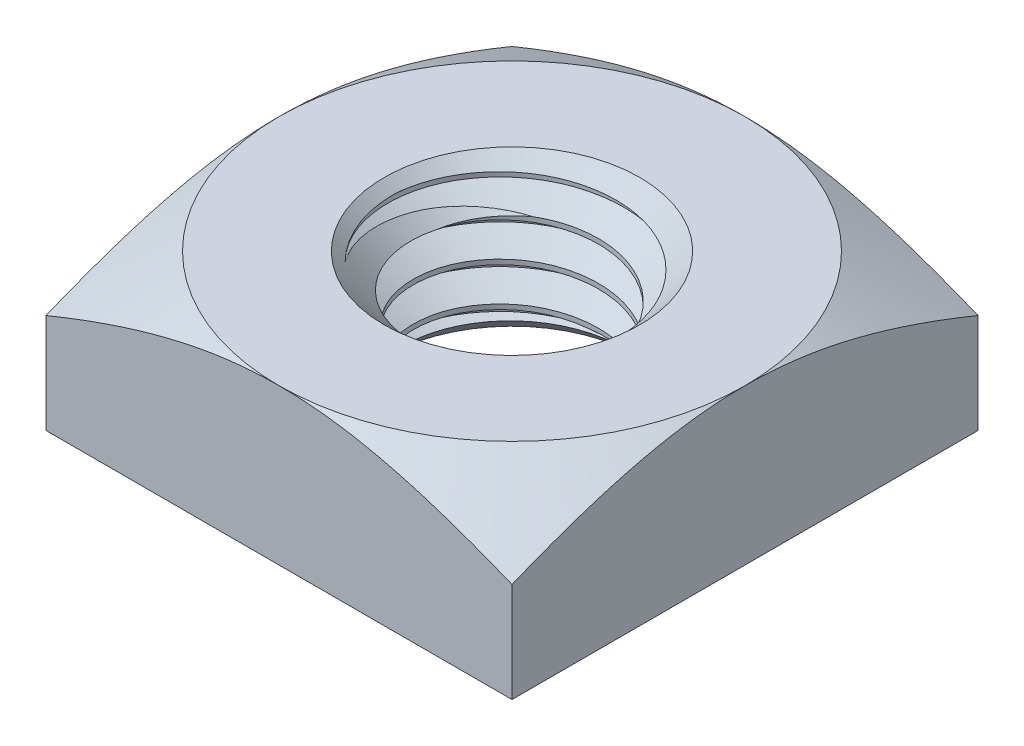
from build123d import *
from build123d.topology import SkipClean

# Parameters (mm, degrees)
BOSS_EXTRUDE1_DEPTH          = 1.5875
BOSS_EXTRUDE1_DEPTH_BACK     = 1.5875
SKETCH2_W                    = 9.525
SKETCH2_H                    = 9.525
SKETCH2_R                    = 2.413
CHAMFER1_SIZE                = 0.1984375
SKETCH6_OUTSIDE_W            = 43.552
SKETCH6_OUTSIDE_H            = 43.552
SKETCH6_OUTSIDE_R            = 4.7625
CUT_EXTRUDE2_DEPTH           = 8.446035019
CUT_EXTRUDE2_DRAFT           = -60
SWEEP1_PITCH                 = 0.79375
SKETCH5_R                    = 2.6114375
CUT_EXTRUDE1_OTHER_WAY_DEPTH = 8.830152766
CUT_EXTRUDE1_OTHER_WAY_TAPER = -45


# Read off the part's stored shape, not the designer's step: Mirror1
with BuildPart() as part:
    # Sketch2 → Boss-Extrude1 (new, two sides: drawn at the far end of the back side and taken through both)
    with BuildSketch(Plane(origin=(0, 0, 0), x_dir=(1, 0, 0), z_dir=(0, 1, 0)).offset(-BOSS_EXTRUDE1_DEPTH_BACK)):
        Rectangle(SKETCH2_W, SKETCH2_H)
        with Locations(Location((0, 0, 0), (0, 0, 90))):
            Circle(SKETCH2_R, mode=Mode.SUBTRACT)
    extrude(amount=BOSS_EXTRUDE1_DEPTH + BOSS_EXTRUDE1_DEPTH_BACK)

    # Chamfer1
    chamfer1_edges = [part.edges().sort_by_distance(p)[0] for p in [
        (0, 1.5875, 2.413),
        (0, -1.5875, 2.413),
    ]]
    chamfer(chamfer1_edges, length=CHAMFER1_SIZE)


with BuildPart() as cut_extrude2_tool:
    # Sketch6 outside → Cut-Extrude2 (with draft: the straight prism first)
    with BuildSketch(Plane(origin=(0, 1.5875, 0), x_dir=(1, 0, 0), z_dir=(0, 1, 0))):
        Rectangle(SKETCH6_OUTSIDE_W, SKETCH6_OUTSIDE_H)
        Circle(SKETCH6_OUTSIDE_R, mode=Mode.SUBTRACT)
    extrude(amount=-CUT_EXTRUDE2_DEPTH)
    # Cut-Extrude2: the draft: its side faces are tilted about the plane it starts from
    cut_extrude2_sides = [cut_extrude2_tool.faces().sort_by_distance(p)[0] for p in [
        (0, -2.635517509, 21.776),
        (21.776, -2.635517509, 0),
        (0, -2.635517509, -21.776),
        (-21.776, -2.635517509, 0),
        (-4.7625, -2.635517509, 0),
    ]]
    draft(cut_extrude2_sides, Plane(origin=(0, 1.5875, 0), x_dir=(1, 0, 0), z_dir=(0, 1, 0)), CUT_EXTRUDE2_DRAFT)


with BuildPart() as part_1:
    add(part.part)

    # Cut-Extrude2: cut by cut_extrude2_tool
    add(cut_extrude2_tool.part, mode=Mode.SUBTRACT)

    # Sweep1: the profile of Sketch4 screwed along a right-hand helix of 5 turns, 8 arcs to a turn; built about Z, then put on its axis
    sweep1_z = Axis((0, 0, 0), (0, 0, 1))
    sweep1_corners = [(1.897444252, 0, -0.29765625), (1.897444252, 0, -0.396875), (2.455962979, 0, -0.719335938), (2.455962979, 0, 0.024804687)]
    with BuildLine(mode=Mode.PRIVATE) as sweep1_profile:
        Line(sweep1_corners[0], sweep1_corners[1])
        Line(sweep1_corners[1], sweep1_corners[2])
        Line(sweep1_corners[2], sweep1_corners[3])
        Line(sweep1_corners[3], sweep1_corners[0])
    sweep1_cap = Face(sweep1_profile.wire())
    sweep1_turn_angles = [0, 22.5, 45, 67.5, 90, 112.5, 135, 157.5, 180, 202.5, 225, 247.5, 270, 292.5, 315, 337.5, 360]
    sweep1_turn_weights = [1, 0.9238795325112867, 1, 0.9238795325112867, 1, 0.9238795325112867, 1, 0.9238795325112867, 1, 0.9238795325112867, 1, 0.9238795325112867, 1, 0.9238795325112867, 1, 0.9238795325112867, 1]
    sweep1_turn_rails = [Edge.make_bspline([Vector(p[0], p[1], 0).rotate(sweep1_z, sweep1_turn_angles[k]) / sweep1_turn_weights[k] + Vector(0, 0, p[2] + SWEEP1_PITCH * sweep1_turn_angles[k] / 360) for k in range(17)], [0, 0, 0, 1, 1, 2, 2, 3, 3, 4, 4, 5, 5, 6, 6, 7, 7, 8, 8, 8], 2, sweep1_turn_weights) for p in sweep1_corners]
    sweep1_turn_sides = [Face.make_surface_from_curves(sweep1_turn_rails[p[0]], sweep1_turn_rails[p[1]]) for p in [(0, 1), (1, 2), (2, 3), (3, 0)]]
    sweep1 = Plane(origin=(0, 1.5875, 0), x_dir=(0, 0, 1), z_dir=(0, -1, 0)) * Solid(Shell([*[p.moved(Location((0, 0, SWEEP1_PITCH * i))) for i in range(5) for p in sweep1_turn_sides], sweep1_cap, sweep1_cap.rotate(sweep1_z, 1800).moved(Location((0, 0, SWEEP1_PITCH * 1800 / 360)))]))
    add(sweep1)

    # Cut-Extrude1 cone 1 section (through the dimple's axis) → Cut-Extrude1 (revolve, cut)
    with SkipClean():  # the faces are left unmerged after this step: merging them gives an invalid solid
        with BuildSketch(Plane(origin=(0, 1.5875, 0), x_dir=(0, 0, 1), z_dir=(1, 0, 0))):
            Polygon((0, 0), (2.6114375, 0), (0, 2.6114375), align=None)
        revolve(axis=Axis((0, 1.5875, 0), (0, -1, 0)), mode=Mode.SUBTRACT)

    # Sketch5 → Cut-Extrude1 other way (cut)
    with SkipClean():  # the faces are left unmerged after this step: merging them gives an invalid solid
        with BuildSketch(Plane(origin=(0, 1.5875, 0), x_dir=(1, 0, 0), z_dir=(0, 1, 0))):
            Circle(SKETCH5_R)
        extrude(amount=CUT_EXTRUDE1_OTHER_WAY_DEPTH, taper=CUT_EXTRUDE1_OTHER_WAY_TAPER, mode=Mode.SUBTRACT)

    # Mirror1 outline → Mirror1 (revolve, cut)
    with SkipClean():  # the faces are left unmerged after this step: merging them gives an invalid solid
        with BuildSketch(Plane.XY):
            Polygon((2.6114375, -1.5875), (1.897440377, -0.873502877), (1.897440377, -2.406054787), (2.6114375, -2.406054787), align=None)
        revolve(axis=Axis((0, 0, 0), (0, 1, 0)), mode=Mode.SUBTRACT)


solid = part_1.part
